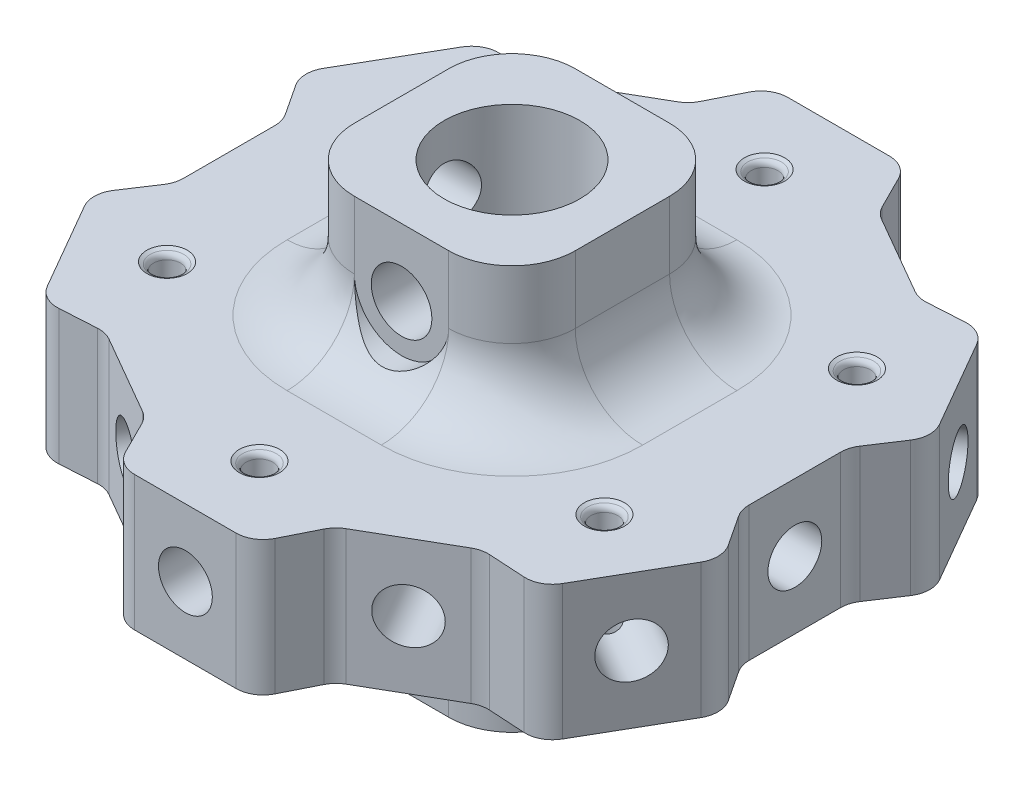
from build123d import *

# Parameters (mm, degrees)
BOSS_EXTRUDE1_DEPTH      = 5
BOSS_EXTRUDE2_DEPTH      = 15
BOSS_EXTRUDE2_DEPTH_BACK = 15
SKETCH5_W                = 16.4
SKETCH5_H                = 16.4
SKETCH5_R                = 5.04
FILLET1_R                = 2
FILLET2_R                = 4.7
FILLET3_R                = 5
SKETCH2_R                = 1
CUT_EXTRUDE1_DEPTH       = 40.039197816
SKETCH3_R                = 2
CUT_EXTRUDE2_DEPTH       = 5.5
SKETCH4_R                = 2
CUT_EXTRUDE3_DEPTH       = 13
CIRPATTERN4_COUNT        = 6
CUT_EXTRUDE4_REACH       = 44.591
CUT_EXTRUDE4_END_RADIUS  = 5.04
SKETCH6_R                = 2.25
SKETCH7_R                = 3.5
CUT_EXTRUDE5_DEPTH       = 43.591066852
CIRPATTERN5_COUNT        = 2
CIRPATTERN5_ANGLE        = 90
CIRPATTERN7_COUNT        = 6
FILLET4_R                = 0.5


with BuildPart() as part:
    # Sketch1 → Boss-Extrude1 (new, symmetric)
    with BuildSketch(Plane(origin=(0, 0, 0), x_dir=(1, 0, 0), z_dir=(0, 1, 0))):
        Polygon((-5, 24.25), (5, 24.25), (7.035898385, 20.186533479), (13.964101615, 16.186533479), (18.501116042, 16.455127019), (23.501116042, 7.794872981), (21, 4), (21, -4), (23.501116042, -7.794872981), (18.501116042, -16.455127019), (13.964101615, -16.186533479), (7.035898385, -20.186533479), (5, -24.25), (-5, -24.25), (-7.035898385, -20.186533479), (-13.964101615, -16.186533479), (-18.501116042, -16.455127019), (-23.501116042, -7.794872981), (-21, -4), (-21, 4), (-23.501116042, 7.794872981), (-18.501116042, 16.455127019), (-13.964101615, 16.186533479), (-7.035898385, 20.186533479), align=None)
    extrude(amount=BOSS_EXTRUDE1_DEPTH, both=True)

    # Sketch5 → Boss-Extrude2 (add, two sides: drawn at the far end of the back side and taken through both)
    with BuildSketch(Plane(origin=(0, 0, 0), x_dir=(1, 0, 0), z_dir=(0, 1, 0)).offset(-BOSS_EXTRUDE2_DEPTH_BACK)):
        Rectangle(SKETCH5_W, SKETCH5_H)
        with Locations(Location((0, 0, 0), (0, 0, 90))):
            Circle(SKETCH5_R, mode=Mode.SUBTRACT)
    extrude(amount=BOSS_EXTRUDE2_DEPTH + BOSS_EXTRUDE2_DEPTH_BACK)

    # Fillet1
    fillet1_edges = [part.edges().sort_by_distance(p)[0] for p in [
        (-5, 0, -24.25),
        (5, 0, -24.25),
        (7.035898385, 0, -20.186533479),
        (13.964101615, 0, -16.186533479),
        (18.501116042, 0, -16.455127019),
        (23.501116042, 0, -7.794872981),
        (21, 0, -4),
        (21, 0, 4),
        (23.501116042, 0, 7.794872981),
        (18.501116042, 0, 16.455127019),
        (13.964101615, 0, 16.186533479),
        (7.035898385, 0, 20.186533479),
        (5, 0, 24.25),
        (-5, 0, 24.25),
        (-7.035898385, 0, 20.186533479),
        (-13.964101615, 0, 16.186533479),
        (-18.501116042, 0, 16.455127019),
        (-23.501116042, 0, 7.794872981),
        (-21, 0, 4),
        (-21, 0, -4),
        (-23.501116042, 0, -7.794872981),
        (-18.501116042, 0, -16.455127019),
        (-13.964101615, 0, -16.186533479),
        (-7.035898385, 0, -20.186533479),
    ]]
    fillet(fillet1_edges, radius=FILLET1_R)

    # Fillet2
    fillet2_edges = [part.edges().sort_by_distance(p)[0] for p in [
        (8.2, 10, 8.2),
        (8.2, 10, -8.2),
        (-8.2, 10, -8.2),
        (-8.2, 10, 8.2),
        (8.2, -10, 8.2),
        (8.2, -10, -8.2),
        (-8.2, -10, -8.2),
        (-8.2, -10, 8.2),
    ]]
    fillet(fillet2_edges, radius=FILLET2_R)

    # Fillet3
    fillet3_edges = [part.edges().sort_by_distance(p)[0] for p in [
        (0, 5, -8.2),
        (8.2, 5, 0),
        (0, 5, 8.2),
        (-8.2, 5, 0),
        (-8.2, -5, 0),
        (0, -5, -8.2),
        (8.2, -5, 0),
        (0, -5, 8.2),
        (6.823401872, 5, -6.823401872),
        (6.823401872, 5, 6.823401872),
        (-6.823401872, 5, -6.823401872),
        (-6.823401872, 5, 6.823401872),
        (-6.823401872, -5, -6.823401872),
        (6.823401872, -5, -6.823401872),
        (6.823401872, -5, 6.823401872),
        (-6.823401872, -5, 6.823401872),
    ]]
    fillet(fillet3_edges, radius=FILLET3_R)

    # Sketch2 → Cut-Extrude1 (cut, through all)
    with BuildSketch(Plane(origin=(0, 5, 0), x_dir=(1, 0, 0), z_dir=(0, 1, 0))):
        with Locations(Location((0, 18.75, 0), (0, 0, 270))):
            Circle(SKETCH2_R)
        with Locations(Location((16.237976321, 9.375, 0), (0, 0, 270))):
            Circle(SKETCH2_R)
        with Locations(Location((16.237976321, -9.375, 0), (0, 0, 270))):
            Circle(SKETCH2_R)
        with Locations(Location((0, -18.75, 0), (0, 0, 270))):
            Circle(SKETCH2_R)
        with Locations(Location((-16.237976321, -9.375, 0), (0, 0, 270))):
            Circle(SKETCH2_R)
        with Locations(Location((-16.237976321, 9.375, 0), (0, 0, 270))):
            Circle(SKETCH2_R)
    extrude(amount=-CUT_EXTRUDE1_DEPTH, mode=Mode.SUBTRACT)

    # Sketch3 → Cut-Extrude2 (cut)
    with BuildSketch(Plane(origin=(0, 0, -24.25), x_dir=(-1, 0, 0), z_dir=(0, 0, -1))):
        Circle(SKETCH3_R)
    cut_extrude2 = extrude(amount=-CUT_EXTRUDE2_DEPTH, mode=Mode.SUBTRACT)

    # Sketch4 → Cut-Extrude3 (cut)
    with BuildSketch(Plane(origin=(10.5, 0, -18.186533479), x_dir=(-0.8660254037844383, 0, -0.5000000000000009), z_dir=(0.5000000000000008, 0, -0.8660254037844382))):
        Circle(SKETCH4_R)
    cut_extrude3 = extrude(amount=-CUT_EXTRUDE3_DEPTH, mode=Mode.SUBTRACT)

    # CirPattern4: Cut-Extrude2, Cut-Extrude3 ×6 about axis
    cirpattern4_axis = Axis((0, 0, 0), (0, 1, 0))
    add([cut_extrude2.rotate(cirpattern4_axis, i * 360 / CIRPATTERN4_COUNT) for i in range(1, CIRPATTERN4_COUNT)], mode=Mode.SUBTRACT)
    add([cut_extrude3.rotate(cirpattern4_axis, i * 360 / CIRPATTERN4_COUNT) for i in range(1, CIRPATTERN4_COUNT)], mode=Mode.SUBTRACT)

    # Cut-Extrude4: up to this cylinder (the profile starts outside it)
    cut_extrude4_end = Plane(origin=(0, -10, 0), z_dir=(0, -1, 0)) * Cylinder(CUT_EXTRUDE4_END_RADIUS, 100.262, mode=Mode.PRIVATE)
    # Sketch6 → Cut-Extrude4 (cut, up to the surface)
    with BuildSketch(Plane.XY.offset(8.2), mode=Mode.PRIVATE) as cut_extrude4_sk1:
        with Locations((0, -10)):
            Circle(SKETCH6_R)
    cut_extrude4_tool1 = extrude(cut_extrude4_sk1.sketch, amount=-CUT_EXTRUDE4_REACH, mode=Mode.PRIVATE) - cut_extrude4_end
    cut_extrude4 = cut_extrude4_tool1.solids().sort_by_distance((0, -10, 8.2))[0]
    add(cut_extrude4, mode=Mode.SUBTRACT)

    # Sketch7 → Cut-Extrude5 (cut, through all)
    with BuildSketch(Plane.XY.offset(8.2)):
        with Locations((0, -10)):
            Circle(SKETCH7_R)
    cut_extrude5 = extrude(amount=CUT_EXTRUDE5_DEPTH, mode=Mode.SUBTRACT)

    # CirPattern5: Cut-Extrude4, Cut-Extrude5 ×2 about axis
    cirpattern5_axis = Axis((0, 60, 0), (0, -1, 0))
    add([cut_extrude4.rotate(cirpattern5_axis, i * CIRPATTERN5_ANGLE / (CIRPATTERN5_COUNT - 1)) for i in range(1, CIRPATTERN5_COUNT)], mode=Mode.SUBTRACT)
    add([cut_extrude5.rotate(cirpattern5_axis, i * CIRPATTERN5_ANGLE / (CIRPATTERN5_COUNT - 1)) for i in range(1, CIRPATTERN5_COUNT)], mode=Mode.SUBTRACT)

    # Mirror1: read off the stored shape, not the designer's step
    # Mirror1: loft between two sections, ruled curve by curve
    mirror1_from = [
        Edge.make_three_point_arc((2.25, 10, 4.509651452), (0, 12.25, 4.509651452), (-2.25, 10, 4.509651452)),
        Edge.make_three_point_arc((-2.25, 10, 4.509651452), (0, 7.75, 4.509651452), (2.25, 10, 4.509651452)),
    ]
    mirror1_to = [
        Edge.make_three_point_arc((2.25, 10, 8.2), (0, 12.25, 8.2), (-2.25, 10, 8.2)),
        Edge.make_three_point_arc((-2.25, 10, 8.2), (0, 7.75, 8.2), (2.25, 10, 8.2)),
    ]
    mirror1 = Solid(Shell([*[Face.make_surface_from_curves(mirror1_from[k], mirror1_to[k]) for k in range(2)], Face(Wire(mirror1_from)), Face(Wire(mirror1_to))]))
    add(mirror1, mode=Mode.SUBTRACT)

    # Mirror1 2: loft between two sections, ruled curve by curve
    mirror1_2_from = [
        Edge.make_three_point_arc((-4.509651452, 10, 2.25), (-4.509651452, 12.25, 0), (-4.509651452, 10, -2.25)),
        Edge.make_three_point_arc((-4.509651452, 10, -2.25), (-4.509651452, 7.75, 0), (-4.509651452, 10, 2.25)),
    ]
    mirror1_2_to = [
        Edge.make_three_point_arc((-8.2, 10, 2.25), (-8.2, 12.25, 0), (-8.2, 10, -2.25)),
        Edge.make_three_point_arc((-8.2, 10, -2.25), (-8.2, 7.75, 0), (-8.2, 10, 2.25)),
    ]
    mirror1_2 = Solid(Shell([*[Face.make_surface_from_curves(mirror1_2_from[k], mirror1_2_to[k]) for k in range(2)], Face(Wire(mirror1_2_from)), Face(Wire(mirror1_2_to))]))
    add(mirror1_2, mode=Mode.SUBTRACT)

    # Mirror1 3: loft between two sections, ruled curve by curve
    mirror1_3_from = [
        Edge.make_three_point_arc((-9.629753475, 10, 3.5), (-9.629753475, 7.525126266, 2.474873734), (-9.629753475, 6.5, 0)),
        Edge.make_three_point_arc((-9.629753475, 6.5, 0), (-9.629753475, 7.525126266, -2.474873734), (-9.629753475, 10, -3.5)),
        Edge.make_line((-9.629753475, 10, -3.5), (-9.629753475, 10, 3.5)),
    ]
    mirror1_3_to = [
        Edge.make_three_point_arc((-8.19999239, 10, 3.5), (-8.19999239, 7.525126266, 2.474873734), (-8.19999239, 6.5, 0)),
        Edge.make_three_point_arc((-8.19999239, 6.5, 0), (-8.19999239, 7.525126266, -2.474873734), (-8.19999239, 10, -3.5)),
        Edge.make_line((-8.19999239, 10, -3.5), (-8.19999239, 10, 3.5)),
    ]
    mirror1_3 = Solid(Shell([*[Face.make_surface_from_curves(mirror1_3_from[k], mirror1_3_to[k]) for k in range(3)], Face(Wire(mirror1_3_from)), Face(Wire(mirror1_3_to))]))
    add(mirror1_3, mode=Mode.SUBTRACT)

    # Mirror1 4: loft between two sections, ruled curve by curve
    mirror1_4_from = [
        Edge.make_three_point_arc((3.5, 10, 9.629753475), (2.474873734, 7.525126266, 9.629753475), (0, 6.5, 9.629753475)),
        Edge.make_three_point_arc((0, 6.5, 9.629753475), (-2.474873734, 7.525126266, 9.629753475), (-3.5, 10, 9.629753475)),
        Edge.make_line((-3.5, 10, 9.629753475), (3.5, 10, 9.629753475)),
    ]
    mirror1_4_to = [
        Edge.make_three_point_arc((3.5, 10, 8.19999239), (2.474873734, 7.525126266, 8.19999239), (0, 6.5, 8.19999239)),
        Edge.make_three_point_arc((0, 6.5, 8.19999239), (-2.474873734, 7.525126266, 8.19999239), (-3.5, 10, 8.19999239)),
        Edge.make_line((-3.5, 10, 8.19999239), (3.5, 10, 8.19999239)),
    ]
    mirror1_4 = Solid(Shell([*[Face.make_surface_from_curves(mirror1_4_from[k], mirror1_4_to[k]) for k in range(3)], Face(Wire(mirror1_4_from)), Face(Wire(mirror1_4_to))]))
    add(mirror1_4, mode=Mode.SUBTRACT)

    # Sketch9 → Cut-Revolve1 (revolve, cut)
    with BuildSketch(Plane(origin=(0, 0, 0), x_dir=(0, 0, -1), z_dir=(1, 0, 0)), mode=Mode.PRIVATE) as cut_revolve1_sk:
        Polygon((-18.75, 5), (-17.25, 5), (-18.75, 4.133974596), align=None)
        Polygon((-18.75, -5), (-18.75, -4.133974596), (-17.25, -5), align=None)
    cut_revolve1 = revolve(cut_revolve1_sk.sketch.rotate(Axis((0, 4.133974596, 18.75), (0, 1, 0)), 180), axis=Axis((0, 4.133974596, 18.75), (0, 1, 0)), mode=Mode.SUBTRACT)

    # CirPattern7: Cut-Revolve1 ×6 about axis
    cirpattern7_axis = Axis((0, 0, 0), (0, 1, 0))
    for i in range(1, CIRPATTERN7_COUNT):
        add(cut_revolve1.rotate(cirpattern7_axis, i * 360 / CIRPATTERN7_COUNT), mode=Mode.SUBTRACT)

    # Fillet4
    fillet4_edges = [part.edges().sort_by_distance(p)[0] for p in [
        (-15.737976321, 0, -10.241025404),
        (-17.104001725, 2.000000002, -9.875),
        (-17.104001725, -2.000000002, -9.875),
        (-16.737976321, 0, -8.508974596),
        (0, -4.711324865, 17.75),
        (0, 4.711324865, 17.75),
        (-15.73797632, -4.711324865, 8.508974595),
        (-15.73797632, 4.711324865, 8.508974595),
        (-15.371950917, -4.711324865, -9.875),
        (-15.371950917, 4.711324865, -9.875),
        (1, -4.711324865, -18.75),
        (0.999999998, 4.711324865, -18.749999999),
        (15.371950917, -4.711324865, -9.875),
        (17.104001725, 4.711324865, -8.875),
        (15.737976321, -4.711324865, 8.508974596),
        (16.737976323, 4.711324865, 10.241025407),
    ]]
    fillet(fillet4_edges, radius=FILLET4_R)


solid = part.part
